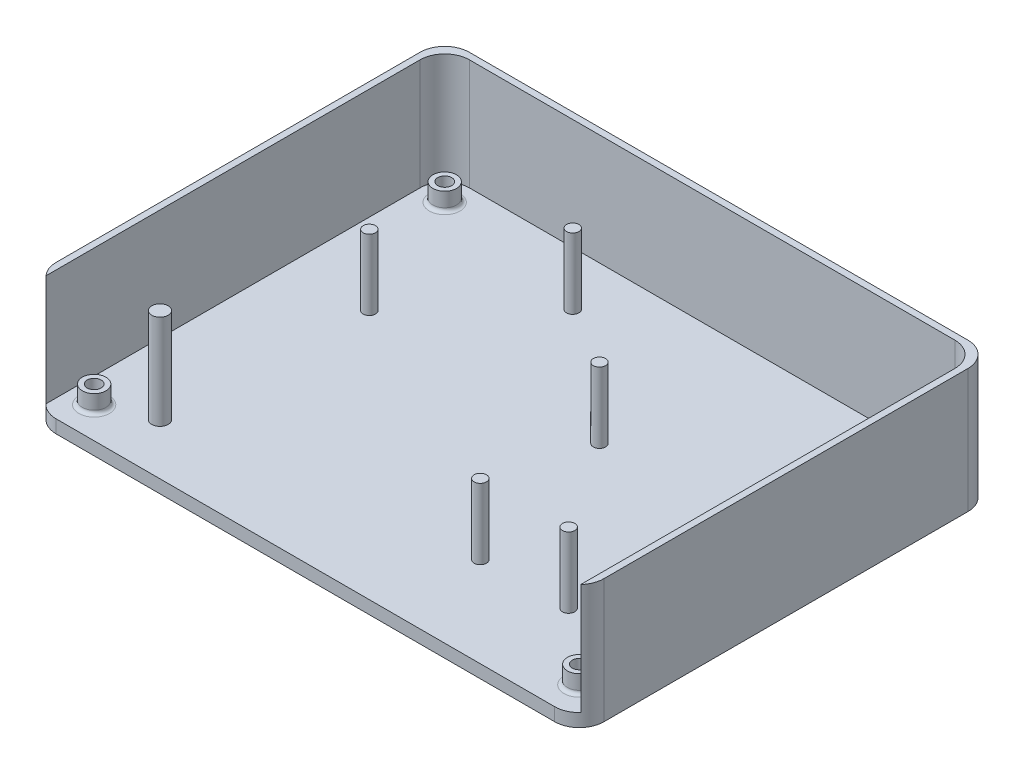
from build123d import *

# Parameters (mm, degrees)
BOSS_EXTRUDE12_DEPTH = 3.175
BOSS_EXTRUDE13_DEPTH = 30.1625
SKETCH1_25_R         = 2.875
SKETCH1_25_R_2       = 1.7
BOSS_EXTRUDE15_DEPTH = 7.525
SKETCH1_27_R         = 1.7
CUT_EXTRUDE3_DEPTH   = 28.575
CHAMFER2_SIZE        = 1.45
SKETCH1_28_R         = 1.5
BOSS_EXTRUDE16_DEPTH = 20.32
SKETCH1_29_R         = 2
BOSS_EXTRUDE17_DEPTH = 26.1874
FILLET3_R            = 6
FILLET4_R            = 0.85
FILLET5_R            = 0.85


with BuildPart() as part:
    # Sketch1 → Boss-Extrude12 (new body)
    with BuildSketch(Plane(origin=(0, 0, 0), x_dir=(1, 0, 0), z_dir=(0, 1, 0))):
        with BuildLine():
            Line((-66.858315384, -50.276221126), (-65.270815384, -50.276221126))
            Line((-65.270815384, -50.276221126), (64.85543465, -50.276221126))
            Line((64.85543465, -50.276221126), (66.44293465, -50.276221126))
            Line((66.44293465, -50.276221126), (66.44293465, 44.266274766))
            ThreePointArc((66.44293465, 44.266274766), (64.685575338, 48.508915454), (60.44293465, 50.266274766))
            Line((60.44293465, 50.266274766), (-60.858315384, 50.266274766))
            ThreePointArc((-60.858315384, 50.266274766), (-65.100956071, 48.508915454), (-66.858315384, 44.266274766))
            Line((-66.858315384, 44.266274766), (-66.858315384, -50.276221126))
        make_face()
    extrude(amount=BOSS_EXTRUDE12_DEPTH)

    # Sketch1<23> → Boss-Extrude13 (add)
    with BuildSketch(Plane(origin=(0, 0, 0), x_dir=(1, 0, 0), z_dir=(0, 1, 0))):
        with BuildLine():
            Line((-66.858315384, 44.266274766), (-66.858315384, -50.276221126))
            Line((-66.858315384, -50.276221126), (-65.270815384, -50.276221126))
            Line((-65.270815384, -50.276221126), (-65.270815384, 42.678774766))
            ThreePointArc((-65.270815384, 42.678774766), (-63.513456071, 46.921415454), (-59.270815384, 48.678774766))
            Line((-59.270815384, 48.678774766), (58.85543465, 48.678774766))
            ThreePointArc((58.85543465, 48.678774766), (63.098075338, 46.921415454), (64.85543465, 42.678774766))
            Line((64.85543465, 42.678774766), (64.85543465, -50.276221126))
            Line((64.85543465, -50.276221126), (66.44293465, -50.276221126))
            Line((66.44293465, -50.276221126), (66.44293465, 44.266274766))
            ThreePointArc((66.44293465, 44.266274766), (64.685575338, 48.508915454), (60.44293465, 50.266274766))
            Line((60.44293465, 50.266274766), (-60.858315384, 50.266274766))
            ThreePointArc((-60.858315384, 50.266274766), (-65.100956071, 48.508915454), (-66.858315384, 44.266274766))
        make_face()
    extrude(amount=BOSS_EXTRUDE13_DEPTH)

    # Sketch1<25> → Boss-Extrude15 (add)
    # profile 1 of 4: a face of its own
    with BuildSketch(Plane(origin=(0, 0, 0), x_dir=(1, 0, 0), z_dir=(0, 1, 0))):
        with Locations((-59.238315384, 42.646274766)):
            Circle(SKETCH1_25_R)
        with Locations((-59.238315384, 42.646274766)):
            Circle(SKETCH1_25_R_2, mode=Mode.SUBTRACT)
    # profile 2 of 4: a face of its own
    with BuildSketch(Plane(origin=(0, 0, 0), x_dir=(1, 0, 0), z_dir=(0, 1, 0))):
        with Locations((58.82293465, 42.646274766)):
            Circle(SKETCH1_25_R)
        with Locations((58.82293465, 42.646274766)):
            Circle(SKETCH1_25_R_2, mode=Mode.SUBTRACT)
    # profile 3 of 4: a face of its own
    with BuildSketch(Plane(origin=(0, 0, 0), x_dir=(1, 0, 0), z_dir=(0, 1, 0))):
        with Locations((-59.238315384, -42.656221126)):
            Circle(SKETCH1_25_R)
        with Locations((-59.238315384, -42.656221126)):
            Circle(SKETCH1_25_R_2, mode=Mode.SUBTRACT)
    # profile 4 of 4: a face of its own
    with BuildSketch(Plane(origin=(0, 0, 0), x_dir=(1, 0, 0), z_dir=(0, 1, 0))):
        with Locations((58.82293465, -42.656221126)):
            Circle(SKETCH1_25_R)
        with Locations((58.82293465, -42.656221126)):
            Circle(SKETCH1_25_R_2, mode=Mode.SUBTRACT)
    extrude(amount=BOSS_EXTRUDE15_DEPTH)

    # Sketch1<27> → Cut-Extrude3 (cut)
    with BuildSketch(Plane(origin=(0, 0, 0), x_dir=(1, 0, 0), z_dir=(0, 1, 0))):
        with Locations((-59.238315384, 42.646274766)):
            Circle(SKETCH1_27_R)
        with Locations((58.82293465, 42.646274766)):
            Circle(SKETCH1_27_R)
        with Locations((-59.238315384, -42.656221126)):
            Circle(SKETCH1_27_R)
        with Locations((58.82293465, -42.656221126)):
            Circle(SKETCH1_27_R)
    extrude(amount=CUT_EXTRUDE3_DEPTH, mode=Mode.SUBTRACT)

    # Chamfer2
    chamfer2_edges = [part.edges().sort_by_distance(p)[0] for p in [
        (57.12293465, 0, 42.656221126),
        (57.12293465, 0, -42.646274766),
        (-60.938315384, 0, 42.656221126),
        (-60.938315384, 0, -42.646274766),
    ]]
    chamfer(chamfer2_edges, length=CHAMFER2_SIZE)

    # Sketch1<28> → Boss-Extrude16 (add)
    with BuildSketch(Plane(origin=(0, 0, 0), x_dir=(1, 0, 0), z_dir=(0, 1, 0))):
        with Locations((-21.087205302, 35.652944211)):
            Circle(SKETCH1_28_R)
        with Locations((20.412794756, -28.347055805)):
            Circle(SKETCH1_28_R)
        with Locations((-45.587205324, 10.652944173)):
            Circle(SKETCH1_28_R)
        with Locations((10.41279469, 10.652944173)):
            Circle(SKETCH1_28_R)
        with Locations((41.412794666, -27.847055789)):
            Circle(SKETCH1_28_R)
    extrude(amount=BOSS_EXTRUDE16_DEPTH)

    # Sketch1<29> → Boss-Extrude17 (add)
    with BuildSketch(Plane(origin=(0, 0, 0), x_dir=(1, 0, 0), z_dir=(0, 1, 0))):
        with Locations((-48.051200616, -37.823742724)):
            Circle(SKETCH1_29_R)
    extrude(amount=BOSS_EXTRUDE17_DEPTH)

    # Fillet3
    fillet3_edges = [part.edges().sort_by_distance(p)[0] for p in [
        (66.44293465, 15.08125, 50.276221126),
        (-66.858315384, 15.08125, 50.276221126),
    ]]
    fillet(fillet3_edges, radius=FILLET3_R)

    # Fillet4
    fillet4_edges = [part.edges().sort_by_distance(p)[0] for p in [
        (-62.113315384, 3.175, -42.646274766),
    ]]
    fillet(fillet4_edges, radius=FILLET4_R)

    # Fillet5
    fillet5_edges = [part.edges().sort_by_distance(p)[0] for p in [
        (-62.113315384, 3.175, 42.656221126),
        (55.94793465, 3.175, 42.656221126),
        (55.94793465, 3.175, -42.646274766),
    ]]
    fillet(fillet5_edges, radius=FILLET5_R)


solid = part.part
